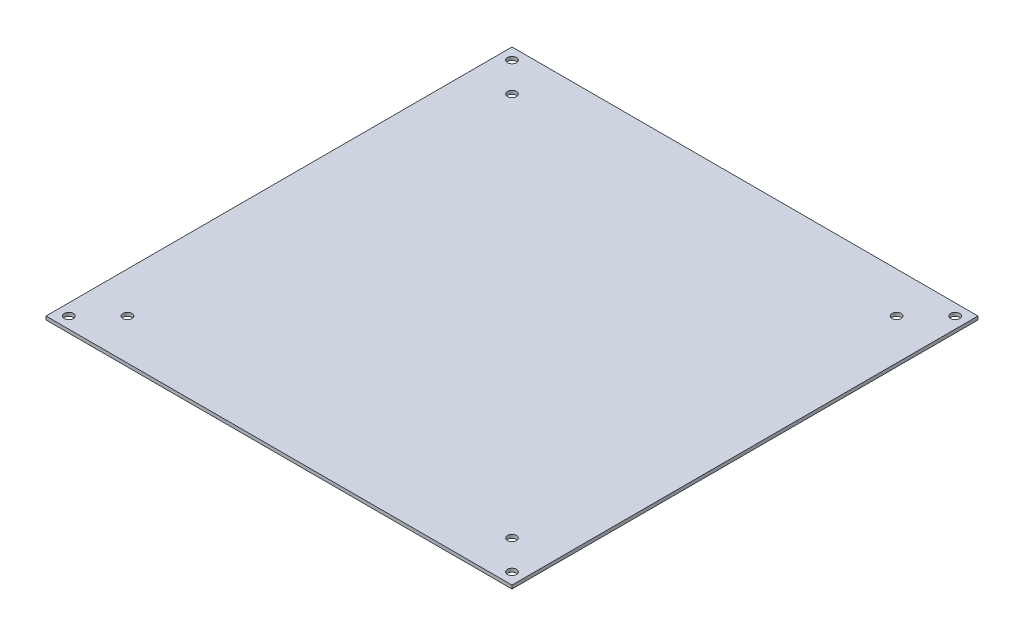
from build123d import *

# Parameters (mm, degrees)
SKETCH1_W           = 214.108538
SKETCH1_H           = 214.108538
SKETCH1_R           = 2.0701
BOSS_EXTRUDE1_DEPTH = 1.5875


with BuildPart() as part:
    # Sketch1 → Boss-Extrude1 (new body)
    with BuildSketch(Plane(origin=(0, 0, 0), x_dir=(1, 0, 0), z_dir=(0, 1, 0))):
        Rectangle(SKETCH1_W, SKETCH1_H)
        with Locations((-101.809169, 101.809169)):
            Circle(SKETCH1_R, mode=Mode.SUBTRACT)
        with Locations((-101.809169, -101.809169)):
            Circle(SKETCH1_R, mode=Mode.SUBTRACT)
        with Locations((101.809169, -101.809169)):
            Circle(SKETCH1_R, mode=Mode.SUBTRACT)
        with Locations((101.809169, 101.809169)):
            Circle(SKETCH1_R, mode=Mode.SUBTRACT)
        with Locations((-88.338784818, 88.338784818)):
            Circle(SKETCH1_R, mode=Mode.SUBTRACT)
        with Locations((88.338784818, -88.338784818)):
            Circle(SKETCH1_R, mode=Mode.SUBTRACT)
        with Locations((88.338784818, 88.338784818)):
            Circle(SKETCH1_R, mode=Mode.SUBTRACT)
        with Locations((-88.338784818, -88.338784818)):
            Circle(SKETCH1_R, mode=Mode.SUBTRACT)
    extrude(amount=BOSS_EXTRUDE1_DEPTH)


solid = part.part
